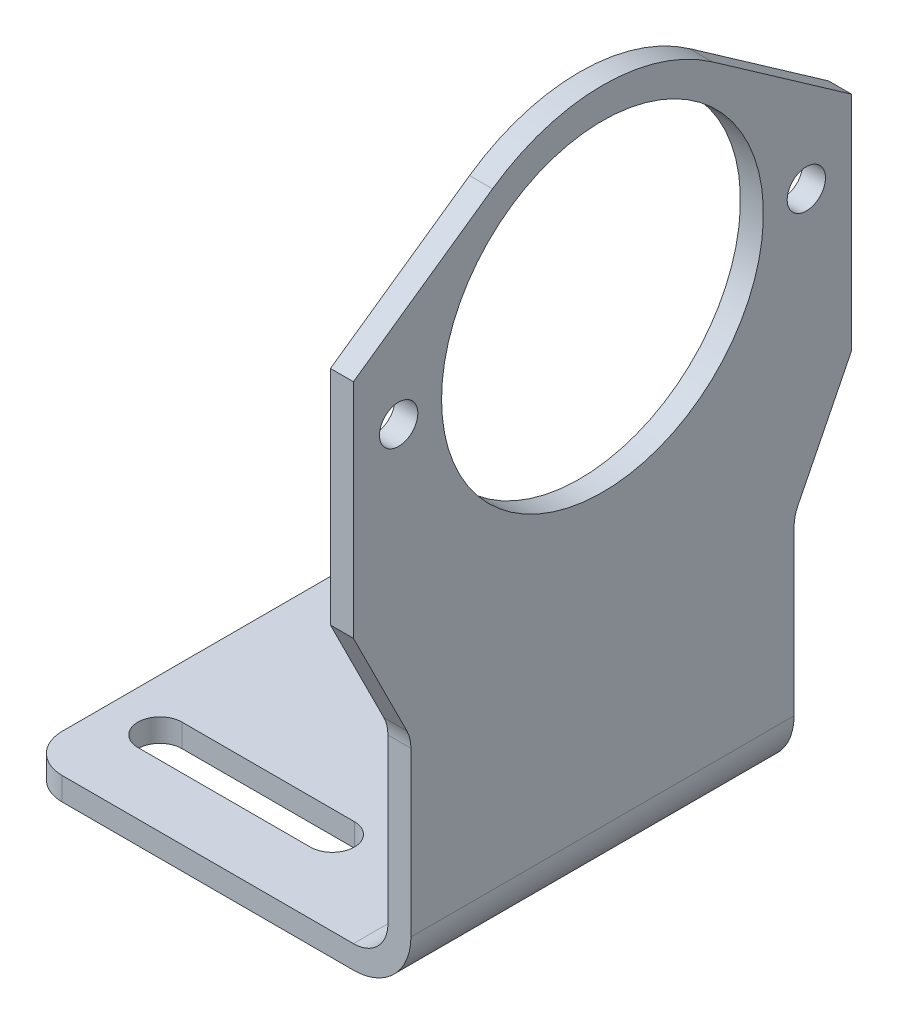
from build123d import *

# Parameters (mm, degrees)
BASE_FLANGE1_DEPTH      = 65
SKETCH6_R               = 42
SKETCH6_R_2             = 5
CUT_EXTRUDE1_DEPTH      = 10
CUT_EXTRUDE2_DEPTH      = 219.477115506
CUT_EXTRUDE2_DEPTH_BACK = 219.477115506
SKETCH8_OUTSIDE_W       = 181.156
SKETCH8_OUTSIDE_H       = 233.656
CUT_EXTRUDE3_DEPTH      = 10
BREAK_CORNER1_START     = -6
BREAK_CORNER1_DEPTH     = 6
BREAK_CORNER1_2_DEPTH   = 6


# Read off the part's stored shape, not the designer's step: Break-Corner1
# Sheet-metal steps are written as plain solids
with BuildPart() as part:
    # Sketch1 → Base-Flange1 (new, symmetric)
    with BuildSketch(Plane.XY):
        with BuildLine():
            Line((-101, 0), (-15, 0))
            ThreePointArc((-15, 0), (-4.393398282, 4.393398282), (0, 15))
            Line((0, 15), (0, 182.5))
            Line((0, 182.5), (-6, 182.5))
            Line((-6, 182.5), (-6, 15))
            ThreePointArc((-6, 15), (-8.636038969, 8.636038969), (-15, 6))
            Line((-15, 6), (-101, 6))
            Line((-101, 6), (-101, 0))
        make_face()
    extrude(amount=BASE_FLANGE1_DEPTH, both=True)

    # Sketch6 → Cut-Extrude1 (cut)
    with BuildSketch(Plane.ZY.offset(6)):
        with Locations((0, 132.5)):
            Circle(SKETCH6_R)
        with Locations((-53.2, 132.5)):
            Circle(SKETCH6_R_2)
        with Locations((53.2, 132.5)):
            Circle(SKETCH6_R_2)
    extrude(amount=-CUT_EXTRUDE1_DEPTH, mode=Mode.SUBTRACT)

    # Sketch8 outside → Cut-Extrude2 (cut, two sides: drawn at the far end of the back side and taken through both)
    with BuildSketch(Plane(origin=(0, 0, 0), x_dir=(0, 0, -1), z_dir=(1, 0, 0)).offset(-CUT_EXTRUDE2_DEPTH_BACK)):
        with Locations((0, 91.25)):
            Rectangle(SKETCH8_OUTSIDE_W, SKETCH8_OUTSIDE_H)
        with BuildLine():
            Line((50, 0), (50, 60))
            Line((50, 60), (65, 90))
            Line((65, 90), (65, 148))
            Line((65, 148), (28.697915295, 173.444226183))
            ThreePointArc((28.697915295, 173.444226183), (0, 182.5), (-28.697915295, 173.444226183))
            Line((-28.697915295, 173.444226183), (-65, 148))
            Line((-65, 148), (-65, 90))
            Line((-65, 90), (-50, 60))
            Line((-50, 60), (-50, 0))
            Line((-50, 0), (50, 0))
        make_face(mode=Mode.SUBTRACT)
    extrude(amount=CUT_EXTRUDE2_DEPTH + CUT_EXTRUDE2_DEPTH_BACK, mode=Mode.SUBTRACT)

    # Sketch7 → Cut-Extrude3 (cut)
    with BuildSketch(Plane(origin=(0, 6, 0), x_dir=(1, 0, 0), z_dir=(0, 1, 0))):
        with BuildLine():
            Line((-42.45, 22.2), (-87.45, 22.2))
            ThreePointArc((-87.45, 22.2), (-93.2, 27.95), (-87.45, 33.7))
            Line((-87.45, 33.7), (-42.45, 33.7))
            ThreePointArc((-42.45, 33.7), (-36.7, 27.95), (-42.45, 22.2))
        make_face()
        with BuildLine():
            Line((-42.45, -33.8), (-87.45, -33.8))
            ThreePointArc((-87.45, -33.8), (-93.2, -28.05), (-87.45, -22.3))
            Line((-87.45, -22.3), (-42.45, -22.3))
            ThreePointArc((-42.45, -22.3), (-36.7, -28.05), (-42.45, -33.8))
        make_face()
    extrude(amount=-CUT_EXTRUDE3_DEPTH, mode=Mode.SUBTRACT)

    # Break-Corner1 outline → Break-Corner1 (add)
    with BuildSketch(Plane.YZ.offset(BREAK_CORNER1_START)):
        with BuildLine():
            Line((60, 50), (62.11145618, 51.05572809))
            ThreePointArc((62.11145618, 51.05572809), (59.936849431, 50.267510105), (57.639320225, 50))
            Line((57.639320225, 50), (60, 50))
        make_face()
        with BuildLine():
            Line((60, -50), (57.639320225, -50))
            ThreePointArc((57.639320225, -50), (59.936849431, -50.267510105), (62.11145618, -51.05572809))
            Line((62.11145618, -51.05572809), (60, -50))
        make_face()
    extrude(amount=BREAK_CORNER1_DEPTH)

    # Break-Corner1 2 outline → Break-Corner1 2 (cut)
    with BuildSketch(Plane(origin=(0, 0, 0), x_dir=(1, 0, 0), z_dir=(0, 1, 0))):
        with BuildLine():
            Line((-101, -50), (-91, -50))
            ThreePointArc((-91, -50), (-98.071067812, -47.071067812), (-101, -40))
            Line((-101, -40), (-101, -50))
        make_face()
        with BuildLine():
            Line((-101, 50), (-101, 40))
            ThreePointArc((-101, 40), (-98.071067812, 47.071067812), (-91, 50))
            Line((-91, 50), (-101, 50))
        make_face()
    extrude(amount=BREAK_CORNER1_2_DEPTH, mode=Mode.SUBTRACT)


solid = part.part
